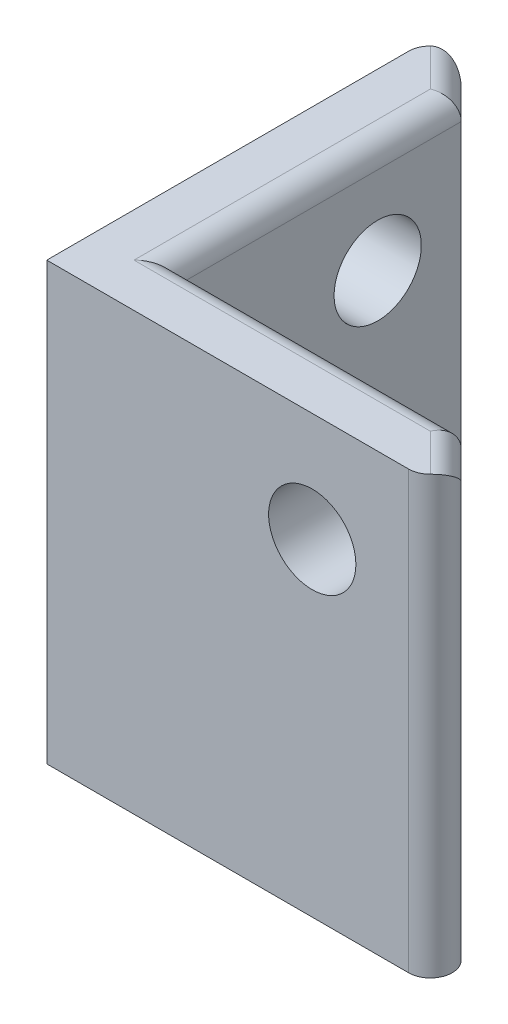
from build123d import *

# Parameters (mm, degrees)
BOSS_EXTRUDE1_DEPTH = 5
BOSS_EXTRUDE2_DEPTH = 15
SKETCH3_R           = 2
CUT_EXTRUDE1_DEPTH  = 34.496268449
SKETCH4_R           = 2
CUT_EXTRUDE2_DEPTH  = 34.496268449
FILLET1_R           = 1
SKETCH5_R           = 1.75
CUT_EXTRUDE3_DEPTH  = 30.043411805


with BuildPart() as part:
    # Sketch1 → Boss-Extrude1 (new body)
    with BuildSketch(Plane(origin=(0, 0, 0), x_dir=(1, 0, 0), z_dir=(0, 1, 0))):
        Polygon((0, 0), (0, 19), (19, 0), align=None)
    extrude(amount=BOSS_EXTRUDE1_DEPTH)

    # Sketch2 → Boss-Extrude2 (add)
    with BuildSketch(Plane(origin=(0, 5, 0), x_dir=(1, 0, 0), z_dir=(0, 1, 0))):
        Polygon((0, 19), (0, 0), (19, 0), (16, 3), (3, 3), (3, 16), align=None)
    extrude(amount=BOSS_EXTRUDE2_DEPTH)

    # Sketch3 → Cut-Extrude1 (cut, through all)
    with BuildSketch(Plane.XY):
        with Locations((12.17, 15)):
            Circle(SKETCH3_R)
    extrude(amount=-CUT_EXTRUDE1_DEPTH, mode=Mode.SUBTRACT)

    # Sketch4 → Cut-Extrude2 (cut, through all)
    with BuildSketch(Plane.ZY):
        with Locations((-12.17, 15)):
            Circle(SKETCH4_R)
    extrude(amount=-CUT_EXTRUDE2_DEPTH, mode=Mode.SUBTRACT)

    # Fillet1
    fillet1_edges = [part.edges().sort_by_distance(p)[0] for p in [
        (9.5, 20, -3),
        (3, 20, -9.5),
        (1.5, 20, -17.5),
        (17.5, 20, -1.5),
        (19, 10, 0),
        (0, 10, -19),
    ]]
    fillet(fillet1_edges, radius=FILLET1_R)

    # Sketch5 → Cut-Extrude3 (cut, through all)
    with BuildSketch(Plane(origin=(0, 5, 0), x_dir=(1, 0, 0), z_dir=(0, 1, 0))):
        with Locations((7, 7)):
            Circle(SKETCH5_R)
    extrude(amount=-CUT_EXTRUDE3_DEPTH, mode=Mode.SUBTRACT)


solid = part.part
